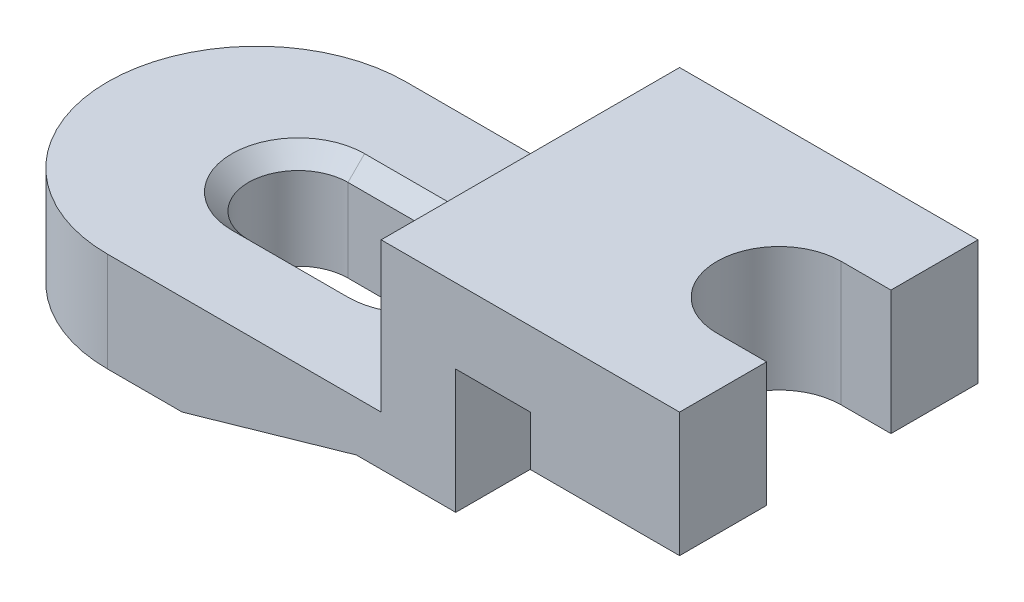
from build123d import *

# Parameters (mm, degrees)
BOSS_EXTRUDE1_DEPTH = 18
FILLET1_RADIUS      = 18
FILLET1_LENGTH      = 12
CUT_EXTRUDE1_DEPTH  = 36
CUT_EXTRUDE2_DEPTH  = 36


with BuildPart() as part:
    # Sketch1 → Boss-Extrude1 (new, symmetric)
    with BuildSketch(Plane.XY):
        Polygon((-27, 12), (-27, 0), (0, 0), (21, 6.021653101), (33, 6.021653101), (33, 21), (42, 21), (42, 15), (60, 15), (60, 30), (24, 30), (24, 12), align=None)
    extrude(amount=BOSS_EXTRUDE1_DEPTH, both=True)

    # Fillet1: full round fillet: the end face becomes a half cylinder, R = half its width
    fillet1_face = Plane((-27, 6, 0), x_dir=(0, -1, 0), z_dir=(-1, 0, 0))  # on the end face: x along it, z out of the body
    fillet1_slab = fillet1_face.offset(-FILLET1_RADIUS / 2) * Box(FILLET1_LENGTH, 2 * FILLET1_RADIUS, FILLET1_RADIUS, mode=Mode.PRIVATE)  # the body's end, R deep
    fillet1_round = Plane((-9, 6, 0), x_dir=(-1, 0, 0), z_dir=(0, -1, 0)) * Cylinder(FILLET1_RADIUS, FILLET1_LENGTH, mode=Mode.PRIVATE)  # its axis R under the face
    add(fillet1_slab - fillet1_round, mode=Mode.SUBTRACT)

    # Sketch3 → Cut-Extrude1 (cut)
    with BuildSketch(Plane(origin=(0, 12, 0), x_dir=(1, 0, 0), z_dir=(0, 1, 0))):
        with BuildLine():
            Line((10, -6), (-4, -6))
            ThreePointArc((-4, -6), (-10, 0), (-4, 6))
            Line((-4, 6), (10, 6))
            ThreePointArc((10, 6), (16, 0), (10, -6))
        make_face()
    extrude(amount=-CUT_EXTRUDE1_DEPTH, mode=Mode.SUBTRACT)

    # Chamfer1: read off the stored shape, not the designer's step
    # Chamfer1: loft between two sections, ruled curve by curve
    chamfer1_from = [
        Edge.make_three_point_arc((10, 10, 6), (14.242640687, 10, 4.242640687), (16, 10, 0)),
        Edge.make_three_point_arc((16, 10, 0), (14.242640687, 10, -4.242640687), (10, 10, -6)),
        Edge.make_three_point_arc((-4, 10, -6), (-8.242640687, 10, -4.242640687), (-10, 10, 0)),
        Edge.make_three_point_arc((-10, 10, 0), (-8.242640687, 10, 4.242640687), (-4, 10, 6)),
        Edge.make_line((-4, 10, 6), (10, 10, 6)),
        Edge.make_line((10, 10, -6), (-4, 10, -6)),
    ]
    chamfer1_to = [
        Edge.make_three_point_arc((10, 12, 8), (15.656854249, 12, 5.656854249), (18, 12, 0)),
        Edge.make_three_point_arc((18, 12, 0), (15.656854249, 12, -5.656854249), (10, 12, -8)),
        Edge.make_three_point_arc((-4, 12, -8), (-9.656854249, 12, -5.656854249), (-12, 12, 0)),
        Edge.make_three_point_arc((-12, 12, 0), (-9.656854249, 12, 5.656854249), (-4, 12, 8)),
        Edge.make_line((-4, 12, 8), (10, 12, 8)),
        Edge.make_line((10, 12, -8), (-4, 12, -8)),
    ]
    chamfer1 = Solid(Shell([*[Face.make_surface_from_curves(chamfer1_from[k], chamfer1_to[k]) for k in range(6)], Face(Wire(chamfer1_from)), Face(Wire(chamfer1_to))]))
    add(chamfer1, mode=Mode.SUBTRACT)

    # Sketch4 → Cut-Extrude2 (cut)
    with BuildSketch(Plane(origin=(0, 30, 0), x_dir=(1, 0, 0), z_dir=(0, 1, 0))):
        with BuildLine():
            Line((54, 7.5), (65.591333802, 7.5))
            ThreePointArc((65.591333802, 7.5), (73.091333802, 0), (65.591333802, -7.5))
            Line((65.591333802, -7.5), (54, -7.5))
            ThreePointArc((54, -7.5), (46.5, 0), (54, 7.5))
        make_face()
    extrude(amount=-CUT_EXTRUDE2_DEPTH, mode=Mode.SUBTRACT)


solid = part.part
